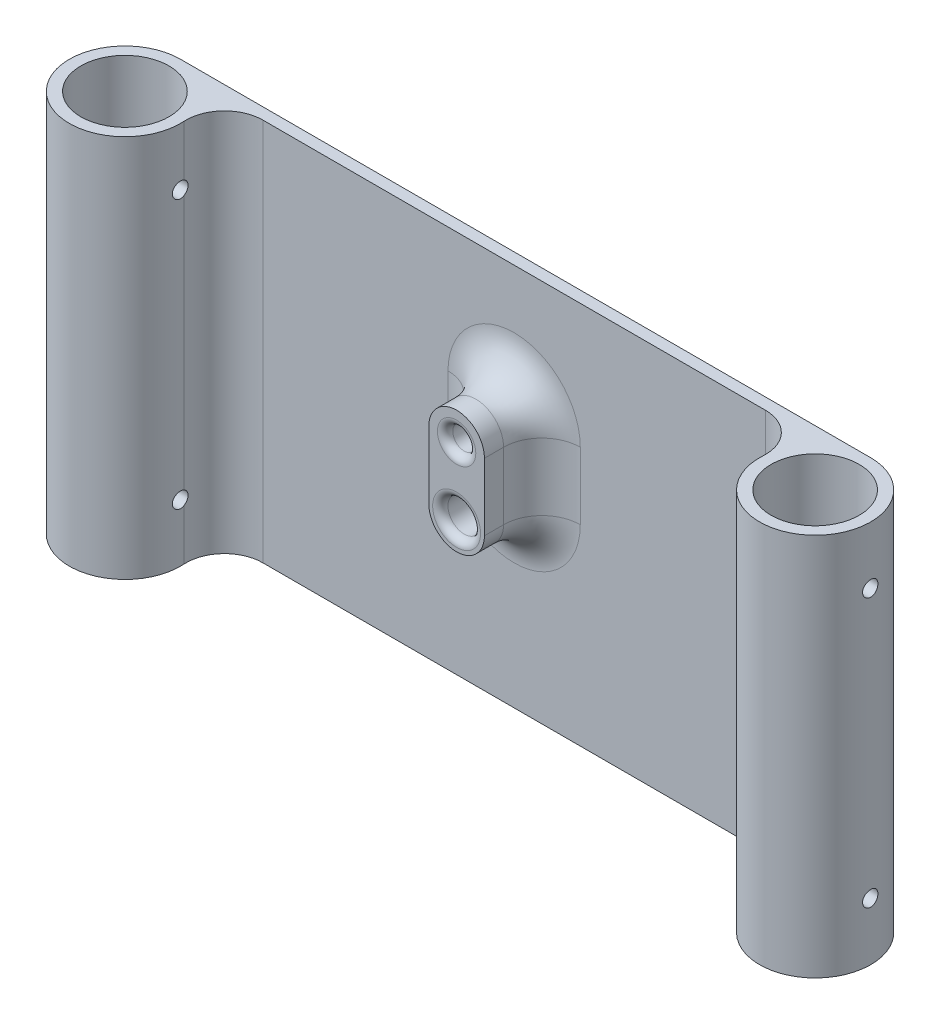
from build123d import *

# Parameters (mm, degrees)
SKETCH1_R               = 11.5
BOSS_EXTRUDE1_DEPTH     = 100
FILLET1_R               = 10
FILLET2_R               = 10
SKETCH2_R               = 4.25
SKETCH2_R_2             = 3
CUT_EXTRUDE1_DEPTH      = 10
BOSS_EXTRUDE2_START     = 15
SKETCH4_R               = 4.25
SKETCH4_R_2             = 3
BOSS_EXTRUDE2_DEPTH     = 15
SKETCH5_R               = 7.25
BOSS_EXTRUDE3_DEPTH     = 10
SKETCH6_R               = 12.109321838
BOSS_EXTRUDE4_DEPTH     = 1
FILLET3_R               = 2
CUT_EXTRUDE2_DEPTH      = 221.069307265
CUT_EXTRUDE2_DEPTH_BACK = 221.069307265
SKETCH7_R               = 2
FILLET4_R               = 2
FILLET5_R               = 2
FILLET6_R               = 10


with BuildPart() as part:
    # Sketch1 → Boss-Extrude1 (new body)
    with BuildSketch(Plane(origin=(0, 0, 0), x_dir=(1, 0, 0), z_dir=(0, 1, 0))):
        with BuildLine():
            Line((-42.539418442, 14.5), (137.460581558, 14.5))
            ThreePointArc((137.460581558, 14.5), (148.724461884, -9.130991184), (123.274320599, -3))
            ThreePointArc((123.274320599, -3), (122.960581558, 0), (123.274320599, 3))
            ThreePointArc((123.274320599, 3), (125.191929138, 7.728529473), (128.628820691, 11.5))
            Line((128.628820691, 11.5), (-33.707657576, 11.5))
            ThreePointArc((-33.707657576, 11.5), (-30.270766023, 7.728529473), (-28.353157483, 3))
            ThreePointArc((-28.353157483, 3), (-28.039418442, 0), (-28.353157483, -3))
            ThreePointArc((-28.353157483, -3), (-53.803298768, -9.130991184), (-42.539418442, 14.5))
        make_face()
        with Locations(Location((-42.539418442, 0, 0), (0, 0, 270))):
            Circle(SKETCH1_R, mode=Mode.SUBTRACT)
        with Locations(Location((137.460581558, 0, 0), (0, 0, 270))):
            Circle(SKETCH1_R, mode=Mode.SUBTRACT)
    extrude(amount=BOSS_EXTRUDE1_DEPTH)

    # Fillet1
    fillet1_edges = [part.edges().sort_by_distance(p)[0] for p in [
        (-33.707657576, 50, -11.5),
    ]]
    fillet(fillet1_edges, radius=FILLET1_R)

    # Fillet2
    fillet2_edges = [part.edges().sort_by_distance(p)[0] for p in [
        (128.628820691, 50, -11.5),
    ]]
    fillet(fillet2_edges, radius=FILLET2_R)

    # Sketch2 → Cut-Extrude1 (cut)
    with BuildSketch(Plane.XY.offset(-11.5)):
        with Locations((47.460581558, 50)):
            Circle(SKETCH2_R)
        with Locations((47.460581558, 67.5)):
            Circle(SKETCH2_R_2)
    extrude(amount=-CUT_EXTRUDE1_DEPTH, mode=Mode.SUBTRACT)

    # Sketch4 → Boss-Extrude2 (add)
    with BuildSketch(Plane.XY.offset(-11.5).offset(BOSS_EXTRUDE2_START)):
        with BuildLine():
            Line((40.210581558, 50), (40.210581558, 67.5))
            ThreePointArc((40.210581558, 67.5), (47.460581558, 74.75), (54.710581558, 67.5))
            Line((54.710581558, 67.5), (54.710581558, 50))
            ThreePointArc((54.710581558, 50), (47.460581558, 42.75), (40.210581558, 50))
        make_face()
        with Locations((47.460581558, 50)):
            Circle(SKETCH4_R, mode=Mode.SUBTRACT)
        with Locations((47.460581558, 67.5)):
            Circle(SKETCH4_R_2, mode=Mode.SUBTRACT)
    extrude(amount=-BOSS_EXTRUDE2_DEPTH)

    # Sketch5 → Boss-Extrude3 (add)
    with BuildSketch(Plane(origin=(0, 0, -14.5), x_dir=(-1, 0, 0), z_dir=(0, 0, -1))):
        with Locations(Location((-47.460581558, 50, 0), (0, 0, 180))):
            Circle(SKETCH5_R)
    extrude(amount=BOSS_EXTRUDE3_DEPTH)

    # Sketch6 → Boss-Extrude4 (add)
    with BuildSketch(Plane(origin=(0, 0, -14.5), x_dir=(-1, 0, 0), z_dir=(0, 0, -1))):
        with Locations(Location((-47.460581558, 50, 0), (0, 0, 180))):
            Circle(SKETCH6_R)
    extrude(amount=BOSS_EXTRUDE4_DEPTH)

    # Fillet3
    fillet3_edges = [part.edges().sort_by_distance(p)[0] for p in [
        (40.210581558, 50, -24.5),
    ]]
    fillet(fillet3_edges, radius=FILLET3_R)

    # Sketch7 → Cut-Extrude2 (cut, two sides: drawn at the far end of the back side and taken through both)
    with BuildSketch(Plane(origin=(-42.539418442, 0, 0), x_dir=(0, 0, -1), z_dir=(1, 0, 0)).offset(-CUT_EXTRUDE2_DEPTH_BACK)):
        with Locations((0, 15)):
            Circle(SKETCH7_R)
        with Locations((0, 85)):
            Circle(SKETCH7_R)
    extrude(amount=CUT_EXTRUDE2_DEPTH + CUT_EXTRUDE2_DEPTH_BACK, mode=Mode.SUBTRACT)

    # Fillet4
    fillet4_edges = [part.edges().sort_by_distance(p)[0] for p in [
        (43.210581558, 50, 3.5),
        (44.460581558, 67.5, 3.5),
    ]]
    fillet(fillet4_edges, radius=FILLET4_R)

    # Fillet5
    # the kernel refuses this fillet: 2 mm, written as the material it adds along each edge
    with BuildSketch(Plane(origin=(47.460581558, 50, -14.5), x_dir=(1, 0, 0), z_dir=(0, 1, 0))) as fillet5_piece_1:
        with BuildLine():
            CenterArc((13.841372646, 2), FILLET5_R, 210, 60)
            Line((12.109321838, 1), (12.074680822, 0.98))
            ThreePointArc((12.074680822, 0.98), (12.069321838, 0.5), (12.069321838, 0))
            Line((12.069321838, 0), (12.109321838, -0.04))
            Line((12.109321838, -0.04), (13.841372646, -0.04))
            Line((13.841372646, -0.04), (13.841372646, 0))
        make_face()
    revolve(axis=Axis((47.460581558, 50, -14.5), (0, 0, -1)))

    # Fillet6
    fillet6_edges = [part.edges().sort_by_distance(p)[0] for p in [
        (47.460581558, 42.75, -11.5),
        (54.710581558, 58.75, -11.5),
        (47.460581558, 74.75, -11.5),
        (40.210581558, 58.75, -11.5),
    ]]
    fillet(fillet6_edges, radius=FILLET6_R)


solid = part.part
